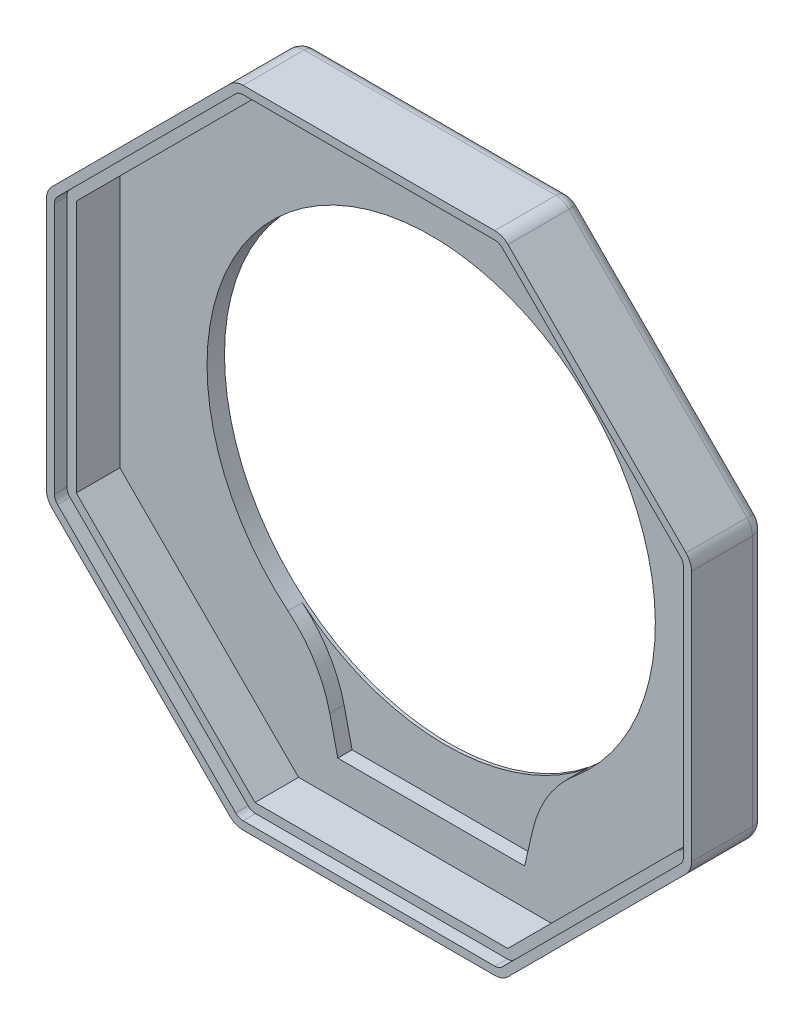
from build123d import *

# Parameters (mm, degrees)
BOSS_EXTRUDE1_DEPTH   = 8.5
BOSS_EXTRUDE1_2_DEPTH = 8.5
BOSS_EXTRUDE1_3_DEPTH = 8.5
BOSS_EXTRUDE1_4_DEPTH = 8.5
BOSS_EXTRUDE2_DEPTH   = 1.4
BOSS_EXTRUDE3_DEPTH   = 8.5
BOSS_EXTRUDE5_DEPTH   = 1
CUT_EXTRUDE1_DEPTH    = 38.942456431
CUT_EXTRUDE2_DEPTH    = 38.942456431
FILLET1_R             = 1
BOSS_EXTRUDE6_START   = 1.4
BOSS_EXTRUDE6_DEPTH   = 1.4
FILLET2_R             = 1
CUT_EXTRUDE3_DEPTH    = 1.4
BOSS_EXTRUDE7_DEPTH   = 0.25
FILLET3_R             = 10
CUT_EXTRUDE4_START    = -5.9
CUT_EXTRUDE4_DEPTH    = 6
CUT_EXTRUDE5_DEPTH    = 1


with BuildPart() as part:
    # Sketch1 → Boss-Extrude1 (new body)
    with BuildSketch(Plane.XY):
        with BuildLine():
            Line((25.9, -10.106810922), (25.9, 10.106810922))
            ThreePointArc((25.9, 10.106810922), (25.785819299, 10.68083607), (25.460660172, 11.167471094))
            Line((25.460660172, 11.167471094), (22.50588745, 14.122243815))
            Line((22.50588745, 14.122243815), (21.515937957, 13.132294321))
            Line((21.515937957, 13.132294321), (24.5, 10.148232278))
            Line((24.5, 10.148232278), (24.5, -10.148232278))
            Line((24.5, -10.148232278), (21.692714652, -12.955517626))
            Line((21.692714652, -12.955517626), (22.682664146, -13.94546712))
            Line((22.682664146, -13.94546712), (25.460660172, -11.167471094))
            ThreePointArc((25.460660172, -11.167471094), (25.785819299, -10.68083607), (25.9, -10.106810922))
        make_face()
    extrude(amount=BOSS_EXTRUDE1_DEPTH)



with BuildPart() as body_2:
    # Sketch1 → Boss-Extrude1 2 (new body)
    with BuildSketch(Plane.XY):
        with BuildLine():
            Line((-16.177281759, -20.450849507), (-11.167471094, -25.460660172))
            ThreePointArc((-11.167471094, -25.460660172), (-10.68083607, -25.785819299), (-10.106810922, -25.9))
            Line((-10.106810922, -25.9), (10.106810922, -25.9))
            ThreePointArc((10.106810922, -25.9), (10.68083607, -25.785819299), (11.167471094, -25.460660172))
            Line((11.167471094, -25.460660172), (15.611596334, -21.016534932))
            Line((15.611596334, -21.016534932), (14.62164684, -20.026585438))
            Line((14.62164684, -20.026585438), (10.148232278, -24.5))
            Line((10.148232278, -24.5), (-10.148232278, -24.5))
            Line((-10.148232278, -24.5), (-15.187332265, -19.460900013))
            Line((-15.187332265, -19.460900013), (-16.177281759, -20.450849507))
        make_face()
    extrude(amount=BOSS_EXTRUDE1_2_DEPTH)


with BuildPart() as body_3:
    # Sketch1 → Boss-Extrude1 3 (new body)
    with BuildSketch(Plane.XY):
        with BuildLine():
            Line((-22.116978721, 14.511152545), (-25.460660172, 11.167471094))
            ThreePointArc((-25.460660172, 11.167471094), (-25.785819299, 10.68083607), (-25.9, 10.106810922))
            Line((-25.9, 10.106810922), (-25.9, -10.106810922))
            ThreePointArc((-25.9, -10.106810922), (-25.785819299, -10.68083607), (-25.460660172, -11.167471094))
            Line((-25.460660172, -11.167471094), (-22.187689399, -14.440441867))
            Line((-22.187689399, -14.440441867), (-21.197739905, -13.450492373))
            Line((-21.197739905, -13.450492373), (-24.5, -10.148232278))
            Line((-24.5, -10.148232278), (-24.5, 10.148232278))
            Line((-24.5, 10.148232278), (-21.127029227, 13.521203051))
            Line((-21.127029227, 13.521203051), (-22.116978721, 14.511152545))
        make_face()
    extrude(amount=BOSS_EXTRUDE1_3_DEPTH)


with BuildPart() as body_4:
    # Sketch1 → Boss-Extrude1 4 (new body)
    with BuildSketch(Plane.XY):
        with BuildLine():
            Line((10.106810922, 25.9), (-10.106810922, 25.9))
            ThreePointArc((-10.106810922, 25.9), (-10.68083607, 25.785819299), (-11.167471094, 25.460660172))
            Line((-11.167471094, 25.460660172), (-17.520784643, 19.107346623))
            Line((-17.520784643, 19.107346623), (-16.530835149, 18.117397129))
            Line((-16.530835149, 18.117397129), (-10.148232278, 24.5))
            Line((-10.148232278, 24.5), (10.148232278, 24.5))
            Line((10.148232278, 24.5), (16.919743879, 17.728488399))
            Line((16.919743879, 17.728488399), (17.909693373, 18.718437893))
            Line((17.909693373, 18.718437893), (11.167471094, 25.460660172))
            ThreePointArc((11.167471094, 25.460660172), (10.68083607, 25.785819299), (10.106810922, 25.9))
        make_face()
    extrude(amount=BOSS_EXTRUDE1_4_DEPTH)


with BuildPart() as part_1:
    add(part.part)

    add(body_2.part)  # Boss-Extrude2 merges body 2

    add(body_3.part)  # Boss-Extrude2 merges body 3

    add(body_4.part)  # Boss-Extrude2 merges body 4
    # Sketch2 → Boss-Extrude2 (add)
    with BuildSketch(Plane.XY.offset(8.5)):
        with BuildLine():
            ThreePointArc((25.460660172, -11.167471094), (25.785819299, -10.68083607), (25.9, -10.106810922))
            Line((25.9, -10.106810922), (25.9, 10.106810922))
            ThreePointArc((25.9, 10.106810922), (25.785819299, 10.68083607), (25.460660172, 11.167471094))
            Line((25.460660172, 11.167471094), (11.167471094, 25.460660172))
            ThreePointArc((11.167471094, 25.460660172), (10.68083607, 25.785819299), (10.106810922, 25.9))
            Line((10.106810922, 25.9), (-10.106810922, 25.9))
            ThreePointArc((-10.106810922, 25.9), (-10.68083607, 25.785819299), (-11.167471094, 25.460660172))
            Line((-11.167471094, 25.460660172), (-25.460660172, 11.167471094))
            ThreePointArc((-25.460660172, 11.167471094), (-25.785819299, 10.68083607), (-25.9, 10.106810922))
            Line((-25.9, 10.106810922), (-25.9, -10.106810922))
            ThreePointArc((-25.9, -10.106810922), (-25.785819299, -10.68083607), (-25.460660172, -11.167471094))
            Line((-25.460660172, -11.167471094), (-11.167471094, -25.460660172))
            ThreePointArc((-11.167471094, -25.460660172), (-10.68083607, -25.785819299), (-10.106810922, -25.9))
            Line((-10.106810922, -25.9), (10.106810922, -25.9))
            ThreePointArc((10.106810922, -25.9), (10.68083607, -25.785819299), (11.167471094, -25.460660172))
            Line((11.167471094, -25.460660172), (25.460660172, -11.167471094))
        make_face()
    extrude(amount=BOSS_EXTRUDE2_DEPTH)

    # Sketch3 → Boss-Extrude3 (add)
    with BuildSketch(Plane(origin=(0, 0, 8.5), x_dir=(-1, 0, 0), z_dir=(0, 0, -1))):
        Polygon((-21.515937957, 13.132294321), (-16.919743879, 17.728488399), (-17.909693373, 18.718437893), (-22.50588745, 14.122243815), align=None)
        Polygon((21.127029227, 13.521203051), (16.530835149, 18.117397129), (17.520784643, 19.107346623), (22.116978721, 14.511152545), align=None)
        Polygon((-21.692714652, -12.955517626), (-22.682664146, -13.94546712), (-15.611596334, -21.016534932), (-14.62164684, -20.026585438), align=None)
        Polygon((15.187332265, -19.460900013), (16.177281759, -20.450849507), (22.187689399, -14.440441867), (21.197739905, -13.450492373), align=None)
    extrude(amount=BOSS_EXTRUDE3_DEPTH)

    # Sketch5 → Boss-Extrude5 (add)
    with BuildSketch(Plane(origin=(0, 0, 8.5), x_dir=(-1, 0, 0), z_dir=(0, 0, -1))):
        Polygon((16.177281759, -20.450849507), (22.187689399, -14.440441867), (21.197739905, -13.450492373), (15.187332265, -19.460900013), align=None)
    extrude(amount=BOSS_EXTRUDE5_DEPTH)

    # Sketch6 → Cut-Extrude1 (cut, through all)
    with BuildSketch(Plane.XY.offset(9.9)):
        with BuildLine():
            Line((-20.332854575, -10.39399953), (-20.332854823, 10.43400047))
            ThreePointArc((-20.332854823, 10.43400047), (-20.450012114, 10.716843181), (-20.732854828, 10.834000465))
            Line((-20.732854828, 10.834000465), (-23.272854828, 10.834000435))
            ThreePointArc((-23.272854828, 10.834000435), (-23.555697539, 10.716843144), (-23.672854823, 10.43400043))
            Line((-23.672854823, 10.43400043), (-23.672854575, -10.39399957))
            ThreePointArc((-23.672854575, -10.39399957), (-23.555697284, -10.676842281), (-23.27285457, -10.793999565))
            Line((-23.27285457, -10.793999565), (-20.73285457, -10.793999535))
            ThreePointArc((-20.73285457, -10.793999535), (-20.450011859, -10.676842244), (-20.332854575, -10.39399953))
        make_face()
        with BuildLine():
            Line((21.277947318, -10.789000444), (23.817947318, -10.789000333))
            ThreePointArc((23.817947318, -10.789000333), (24.100790025, -10.671843033), (24.217947301, -10.389000316))
            Line((24.217947301, -10.389000316), (24.21794639, 10.438999684))
            ThreePointArc((24.21794639, 10.438999684), (24.10078909, 10.721842391), (23.817946373, 10.838999667))
            Line((23.817946373, 10.838999667), (21.277946373, 10.838999556))
            ThreePointArc((21.277946373, 10.838999556), (20.995103665, 10.721842256), (20.87794639, 10.438999538))
            Line((20.87794639, 10.438999538), (20.877947301, -10.389000462))
            ThreePointArc((20.877947301, -10.389000462), (20.995104601, -10.671843169), (21.277947318, -10.789000444))
        make_face()
    extrude(amount=-CUT_EXTRUDE1_DEPTH, mode=Mode.SUBTRACT)

    # Sketch7 → Cut-Extrude2 (cut, through all)
    # profile 1 of 2: a face of its own
    with BuildSketch(Plane.XY.offset(9.9)):
        with BuildLine():
            ThreePointArc((-11.582455432, -19.595401386), (-11.465298194, -19.312558653), (-11.182455502, -19.195401316))
            Line((-11.182455502, -19.195401316), (11.677544498, -19.195397319))
            ThreePointArc((11.677544498, -19.195397319), (11.960387231, -19.312554557), (12.077544568, -19.595397249))
            Line((12.077544568, -19.595397249), (12.077545003, -22.084597249))
            ThreePointArc((12.077545003, -22.084597249), (11.960387765, -22.367439982), (11.677545073, -22.484597319))
            Line((11.677545073, -22.484597319), (9.391545073, -22.484597719))
            Line((9.391545073, -22.484597719), (-8.896454927, -22.484600916))
            Line((-8.896454927, -22.484600916), (-11.182454927, -22.484601316))
            ThreePointArc((-11.182454927, -22.484601316), (-11.46529766, -22.367444078), (-11.582454997, -22.084601386))
            Line((-11.582454997, -22.084601386), (-11.582455432, -19.595401386))
        make_face()
        Polygon((9.391545003, -22.084597719), (11.677545003, -22.084597319), (11.677544568, -19.595397319), (-11.182455432, -19.595401316), (-11.182454997, -22.084601316), (-8.896454997, -22.084600916), align=None, mode=Mode.SUBTRACT)
    # profile 2 of 2: a face of its own
    with BuildSketch(Plane.XY.offset(9.9)):
        Polygon((9.391545003, -22.084597719), (-8.896454997, -22.084600916), (-11.182454997, -22.084601316), (-11.182455432, -19.595401316), (11.677544568, -19.595397319), (11.677545003, -22.084597319), align=None)
    extrude(amount=-CUT_EXTRUDE2_DEPTH, mode=Mode.SUBTRACT)

    # Fillet1
    fillet1_edges = [part_1.edges().sort_by_distance(p)[0] for p in [
        (18.314065633, 18.314065633, 9.9),
        (10.68083607, 25.785819299, 9.9),
        (0, 25.9, 9.9),
        (-10.68083607, 25.785819299, 9.9),
        (-18.314065633, 18.314065633, 9.9),
        (-25.785819299, 10.68083607, 9.9),
        (-25.9, 0, 9.9),
        (-25.785819299, -10.68083607, 9.9),
        (-18.314065633, -18.314065633, 9.9),
        (-10.68083607, -25.785819299, 9.9),
        (0, -25.9, 9.9),
        (10.68083607, -25.785819299, 9.9),
        (18.314065633, -18.314065633, 9.9),
        (25.785819299, -10.68083607, 9.9),
        (25.9, 0, 9.9),
        (25.785819299, 10.68083607, 9.9),
    ]]
    fillet(fillet1_edges, radius=FILLET1_R)

    # Sketch8 → Boss-Extrude6 (add)
    with BuildSketch(Plane(origin=(0, 0, 0), x_dir=(-1, 0, 0), z_dir=(0, 0, -1)).offset(BOSS_EXTRUDE6_START)):
        with BuildLine():
            Line((-11.167471094, 25.460660172), (-25.460660172, 11.167471094))
            ThreePointArc((-25.460660172, 11.167471094), (-25.785819299, 10.68083607), (-25.9, 10.106810922))
            Line((-25.9, 10.106810922), (-25.9, -10.106810922))
            ThreePointArc((-25.9, -10.106810922), (-25.785819299, -10.68083607), (-25.460660172, -11.167471094))
            Line((-25.460660172, -11.167471094), (-11.167471094, -25.460660172))
            ThreePointArc((-11.167471094, -25.460660172), (-10.68083607, -25.785819299), (-10.106810922, -25.9))
            Line((-10.106810922, -25.9), (10.106810922, -25.9))
            ThreePointArc((10.106810922, -25.9), (10.68083607, -25.785819299), (11.167471094, -25.460660172))
            Line((11.167471094, -25.460660172), (25.460660172, -11.167471094))
            ThreePointArc((25.460660172, -11.167471094), (25.785819299, -10.68083607), (25.9, -10.106810922))
            Line((25.9, -10.106810922), (25.9, 10.106810922))
            ThreePointArc((25.9, 10.106810922), (25.785819299, 10.68083607), (25.460660172, 11.167471094))
            Line((25.460660172, 11.167471094), (11.167471094, 25.460660172))
            ThreePointArc((11.167471094, 25.460660172), (10.68083607, 25.785819299), (10.106810922, 25.9))
            Line((10.106810922, 25.9), (-10.106810922, 25.9))
            ThreePointArc((-10.106810922, 25.9), (-10.68083607, 25.785819299), (-11.167471094, 25.460660172))
        make_face()
    extrude(amount=-BOSS_EXTRUDE6_DEPTH)

    # Fillet2
    fillet2_edges = [part_1.edges().sort_by_distance(p)[0] for p in [
        (10.68083607, 25.785819299, -1.4),
        (18.314065633, 18.314065633, -1.4),
        (25.785819299, 10.68083607, -1.4),
        (25.9, 0, -1.4),
        (25.785819299, -10.68083607, -1.4),
        (18.314065633, -18.314065633, -1.4),
        (10.68083607, -25.785819299, -1.4),
        (0, -25.9, -1.4),
        (-10.68083607, -25.785819299, -1.4),
        (-18.314065633, -18.314065633, -1.4),
        (-25.785819299, -10.68083607, -1.4),
        (-25.9, 0, -1.4),
        (-25.785819299, 10.68083607, -1.4),
        (-18.314065633, 18.314065633, -1.4),
        (-10.68083607, 25.785819299, -1.4),
        (0, 25.9, -1.4),
    ]]
    fillet(fillet2_edges, radius=FILLET2_R)

    # Sketch9 → Cut-Extrude3 (cut)
    with BuildSketch(Plane(origin=(0, 0, -1.4), x_dir=(-1, 0, 0), z_dir=(0, 0, -1))):
        with BuildLine():
            ThreePointArc((17.5, 0.5), (-9.5, 16.088457268), (-9.5, -15.088457268))
            Line((-9.5, -15.088457268), (8.5, -15.088457268))
            ThreePointArc((8.5, -15.088457268), (15.088457268, -8.5), (17.5, 0.5))
        make_face()
        with BuildLine():
            Line((8.5, -15.088457268), (-9.5, -15.088457268))
            ThreePointArc((-9.5, -15.088457268), (-0.5, -17.5), (8.5, -15.088457268))
        make_face()
        with BuildLine():
            ThreePointArc((8.5, -15.088457268), (-0.5, -17.5), (-9.5, -15.088457268))
            Line((-9.5, -15.088457268), (-8, -21.588457268))
            Line((-8, -21.588457268), (7, -21.588457268))
            Line((7, -21.588457268), (8.5, -15.088457268))
        make_face()
    extrude(amount=-CUT_EXTRUDE3_DEPTH, mode=Mode.SUBTRACT)

    # Sketch9<3> → Boss-Extrude7 (add)
    with BuildSketch(Plane(origin=(0, 0, -1.4), x_dir=(-1, 0, 0), z_dir=(0, 0, -1))):
        with BuildLine():
            ThreePointArc((8.5, -15.088457268), (-0.5, -17.5), (-9.5, -15.088457268))
            Line((-9.5, -15.088457268), (-8, -21.588457268))
            Line((-8, -21.588457268), (7, -21.588457268))
            Line((7, -21.588457268), (8.5, -15.088457268))
        make_face()
    extrude(amount=-BOSS_EXTRUDE7_DEPTH)

    # Fillet3
    # the kernel refuses this fillet: 10 mm, written as the material it takes off along each edge
    with BuildSketch(Plane(origin=(9.5, -15.088457268, -1.15), x_dir=(0.8205991500669837, 0.5715041862570599, 0), z_dir=(0, 0, 1))) as fillet3_piece_1_section:
        with BuildLine():
            CenterArc((3.893328157, -9.964118034), FILLET3_R, 94.85518398, 37.295015249)
            Line((-2.817436219, -2.550236359), (0, 0))
            ThreePointArc((0, 0), (1.523476235, -0.064587539), (3.046952471, 0))
        make_face()
    fillet3_piece_1 = extrude(amount=10.650543516, mode=Mode.PRIVATE)
    fillet3_piece_1 = split(fillet3_piece_1, bisect_by=Plane(origin=(9.843769385, -15.549562691, 8.5), z_dir=(0, 0, -1)), keep=Keep.TOP, mode=Mode.PRIVATE)
    add(fillet3_piece_1, mode=Mode.SUBTRACT)
    with BuildSketch(Plane(origin=(-8.5, -15.088457268, -1.15), x_dir=(-0.8205991500669784, 0.5715041862570673, 0), z_dir=(0, 0, 1))) as fillet3_piece_2_section:
        with BuildLine():
            CenterArc((3.893328157, 9.964118034), FILLET3_R, 227.849800771, 37.295015249)
            Line((-2.817436219, 2.550236359), (0, 0))
            ThreePointArc((0, 0), (1.523476235, 0.064587539), (3.046952471, 0))
        make_face()
    fillet3_piece_2 = extrude(amount=10.650543516, mode=Mode.PRIVATE)
    fillet3_piece_2 = split(fillet3_piece_2, bisect_by=Plane(origin=(-8.843769385, -15.549562691, 8.5), z_dir=(0, 0, -1)), keep=Keep.TOP, mode=Mode.PRIVATE)
    add(fillet3_piece_2, mode=Mode.SUBTRACT)

    # Sketch10 → Cut-Extrude4 (cut)
    with BuildSketch(Plane(origin=(0, 0, -1.4), x_dir=(-1, 0, 0), z_dir=(0, 0, -1)).offset(CUT_EXTRUDE4_START)):
        with BuildLine():
            Line((-11.167471094, -25.460660172), (-25.460660172, -11.167471094))
            ThreePointArc((-25.460660172, -11.167471094), (-25.785819299, -10.68083607), (-25.9, -10.106810922))
            Line((-25.9, -10.106810922), (-25.9, 10.106810922))
            ThreePointArc((-25.9, 10.106810922), (-25.785819299, 10.68083607), (-25.460660172, 11.167471094))
            Line((-25.460660172, 11.167471094), (-11.167471094, 25.460660172))
            ThreePointArc((-11.167471094, 25.460660172), (-10.68083607, 25.785819299), (-10.106810922, 25.9))
            Line((-10.106810922, 25.9), (10.106810922, 25.9))
            ThreePointArc((10.106810922, 25.9), (10.68083607, 25.785819299), (11.167471094, 25.460660172))
            Line((11.167471094, 25.460660172), (25.460660172, 11.167471094))
            ThreePointArc((25.460660172, 11.167471094), (25.785819299, 10.68083607), (25.9, 10.106810922))
            Line((25.9, 10.106810922), (25.9, -10.106810922))
            ThreePointArc((25.9, -10.106810922), (25.785819299, -10.68083607), (25.460660172, -11.167471094))
            Line((25.460660172, -11.167471094), (11.167471094, -25.460660172))
            ThreePointArc((11.167471094, -25.460660172), (10.68083607, -25.785819299), (10.106810922, -25.9))
            Line((10.106810922, -25.9), (-10.106810922, -25.9))
            ThreePointArc((-10.106810922, -25.9), (-10.68083607, -25.785819299), (-11.167471094, -25.460660172))
        make_face()
    extrude(amount=-CUT_EXTRUDE4_DEPTH, mode=Mode.SUBTRACT)

    # Sketch11 → Cut-Extrude5 (cut)
    with BuildSketch(Plane.XY.offset(4.5)):
        with BuildLine():
            Line((10.106810922, 25.25), (-10.106810922, 25.25))
            ThreePointArc((-10.106810922, 25.25), (-10.432091839, 25.185297603), (-10.707851686, 25.001040764))
            Line((-10.707851686, 25.001040764), (-25.001040764, 10.707851686))
            ThreePointArc((-25.001040764, 10.707851686), (-25.185297603, 10.432091839), (-25.25, 10.106810922))
            Line((-25.25, 10.106810922), (-25.25, -10.106810922))
            ThreePointArc((-25.25, -10.106810922), (-25.185297603, -10.432091839), (-25.001040764, -10.707851686))
            Line((-25.001040764, -10.707851686), (-10.707851686, -25.001040764))
            ThreePointArc((-10.707851686, -25.001040764), (-10.432091839, -25.185297603), (-10.106810922, -25.25))
            Line((-10.106810922, -25.25), (10.106810922, -25.25))
            ThreePointArc((10.106810922, -25.25), (10.432091839, -25.185297603), (10.707851686, -25.001040764))
            Line((10.707851686, -25.001040764), (25.001040764, -10.707851686))
            ThreePointArc((25.001040764, -10.707851686), (25.185297603, -10.432091839), (25.25, -10.106810922))
            Line((25.25, -10.106810922), (25.25, 10.106810922))
            ThreePointArc((25.25, 10.106810922), (25.185297603, 10.432091839), (25.001040764, 10.707851686))
            Line((25.001040764, 10.707851686), (10.707851686, 25.001040764))
            ThreePointArc((10.707851686, 25.001040764), (10.432091839, 25.185297603), (10.106810922, 25.25))
        make_face()
        with BuildLine():
            Line((10.148232278, -24.5), (-10.148232278, -24.5))
            Line((-10.148232278, -24.5), (-24.5, -10.148232278))
            Line((-24.5, -10.148232278), (-24.5, 10.148232278))
            Line((-24.5, 10.148232278), (-10.148232278, 24.5))
            Line((-10.148232278, 24.5), (10.148232278, 24.5))
            Line((10.148232278, 24.5), (23.809232612, 10.838999666))
            Line((23.809232612, 10.838999666), (23.817946373, 10.838999667))
            ThreePointArc((23.817946373, 10.838999667), (24.10078909, 10.721842391), (24.21794639, 10.438999684))
            Line((24.21794639, 10.438999684), (24.217946391, 10.430285888))
            Line((24.217946391, 10.430285888), (24.5, 10.148232278))
            Line((24.5, 10.148232278), (24.5, -10.148232278))
            Line((24.5, -10.148232278), (24.215555624, -10.432676654))
            ThreePointArc((24.215555624, -10.432676654), (24.100790013, -10.671843046), (23.861623621, -10.786608657))
            Line((23.861623621, -10.786608657), (10.148232278, -24.5))
        make_face(mode=Mode.SUBTRACT)
    extrude(amount=-CUT_EXTRUDE5_DEPTH, mode=Mode.SUBTRACT)


solid = part_1.part
